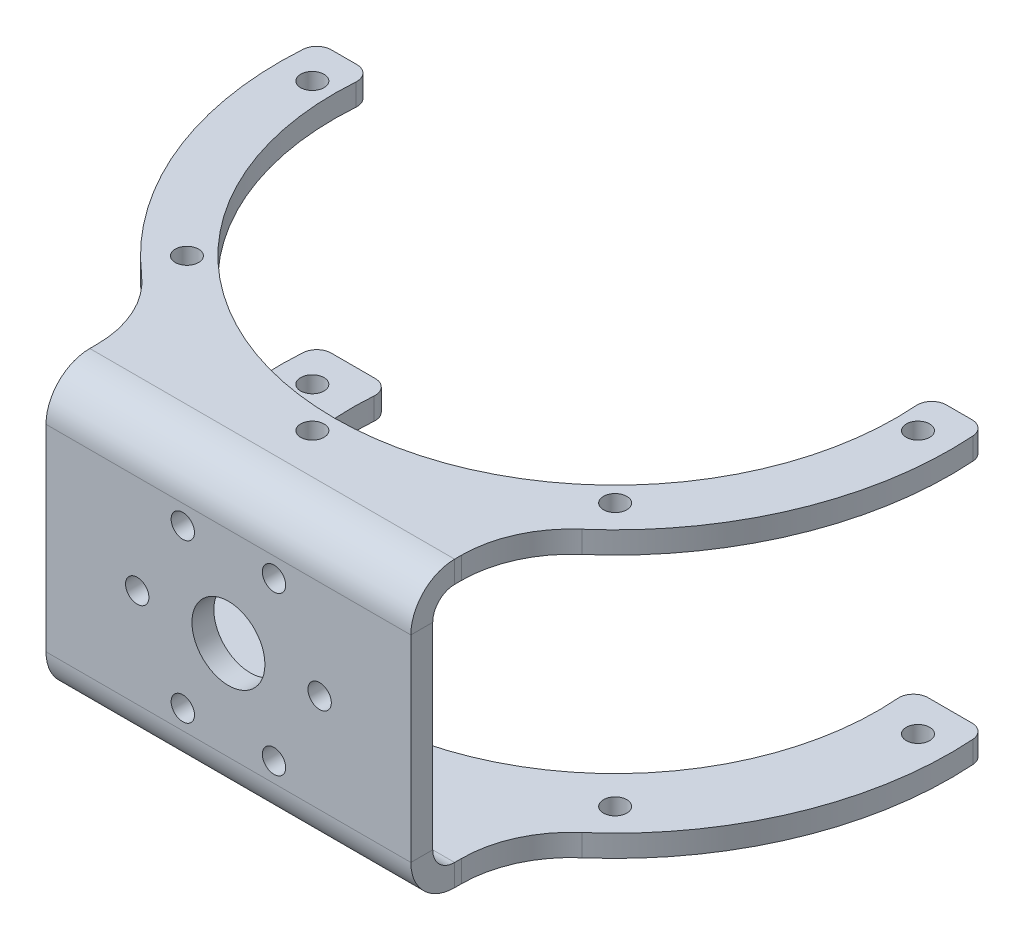
from build123d import *

# Parameters (mm, degrees)
SKETCH1_R                    = 1
BASE_FLANGE1_DEPTH           = 3
EDGE_FLANGE1_STRIP_W         = 18
EDGE_FLANGE1_STRIP_H         = 3
EDGE_FLANGE1_STRIP_CUT_DEPTH = 50
EDGE_FLANGE1_DEPTH           = 50
EDGE_FLANGE1_START           = 3
EDGE_FLANGE1_PROFILE_W       = 50
EDGE_FLANGE1_PROFILE_H       = 30
EDGE_FLANGE1_PROFILE_R       = 1
EDGE_FLANGE1_PROFILE_R_2     = 5
EDGE_FLANGE1_FLAT_DEPTH      = 3
EDGE_FLANGE2_STRIP_W         = 18
EDGE_FLANGE2_STRIP_H         = 3
EDGE_FLANGE2_STRIP_CUT_DEPTH = 50
EDGE_FLANGE2_DEPTH           = 50
EDGE_FLANGE2_START           = 3
EDGE_FLANGE2_PROFILE_R       = 1
EDGE_FLANGE2_FLAT_DEPTH      = 3
FILLET1_R                    = 15
FILLET2_R                    = 2
M3_CLEARANCE_HOLE1_D         = 3.2
M3_CLEARANCE_HOLE1_DEPTH     = 136
M3_CLEARANCE_HOLE1_TIP       = 0.96137699
M3_CLEARANCE_HOLE2_D         = 3.2
M3_CLEARANCE_HOLE2_DEPTH     = 136
M3_CLEARANCE_HOLE2_TIP       = 0.96137699


# Sheet-metal steps are written as plain solids
with BuildPart() as part:
    # Sketch1 → Base-Flange1 (new body)
    with BuildSketch(Plane(origin=(0, 0, 0), x_dir=(1, 0, 0), z_dir=(0, 1, 0))):
        with BuildLine():
            Line((-45.727453461, 5), (-35.65108694, 5))
            ThreePointArc((-35.65108694, 5), (0, -36), (35.65108694, 5))
            Line((35.65108694, 5), (45.727453461, 5))
            ThreePointArc((45.727453461, 5), (41.546682673, -19.745205972), (25, -38.613469153))
            Line((25, -38.613469153), (25, -50))
            Line((25, -50), (-25, -50))
            Line((-25, -50), (-25, -38.613469153))
            ThreePointArc((-25, -38.613469153), (-41.546682673, -19.745205972), (-45.727453461, 5))
        make_face()
        with Locations(Location((-41.5, 0, 0), (0, 0, 270))):
            Circle(SKETCH1_R, mode=Mode.SUBTRACT)
        with Locations(Location((41.5, 0, 0), (0, 0, 270))):
            Circle(SKETCH1_R, mode=Mode.SUBTRACT)
        with Locations(Location((-29.344931419, -29.344931419, 0), (0, 0, 270))):
            Circle(SKETCH1_R, mode=Mode.SUBTRACT)
        with Locations(Location((0, -41.5, 0), (0, 0, 270))):
            Circle(SKETCH1_R, mode=Mode.SUBTRACT)
        with Locations(Location((29.344931419, -29.344931419, 0), (0, 0, 270))):
            Circle(SKETCH1_R, mode=Mode.SUBTRACT)
    extrude(amount=-BASE_FLANGE1_DEPTH)

    # Edge-Flange1 strip (across the edge) → Edge-Flange1 strip cut (cut)
    with BuildSketch(Plane(origin=(-25, 0, 50), x_dir=(0, 0, -1), z_dir=(1, 0, 0))):
        with Locations((-6, -1.5)):
            Rectangle(EDGE_FLANGE1_STRIP_W, EDGE_FLANGE1_STRIP_H)
    extrude(amount=EDGE_FLANGE1_STRIP_CUT_DEPTH, mode=Mode.SUBTRACT)

    # Edge-Flange1 bend section (across the edge) → Edge-Flange1 (add)
    with BuildSketch(Plane(origin=(-25, 0, 50), x_dir=(0, 0, -1), z_dir=(1, 0, 0))):
        with BuildLine():
            Line((-3, 3), (0, 3))
            ThreePointArc((0, 3), (0.878679656, 0.878679656), (3, 0))
            Line((3, 0), (3, -3))
            ThreePointArc((3, -3), (-1.242640687, -1.242640687), (-3, 3))
        make_face()
    extrude(amount=EDGE_FLANGE1_DEPTH)

    # Edge-Flange1 profile (on flange) → Edge-Flange1 flat (add)
    with BuildSketch(Plane.XY.offset(50).offset(EDGE_FLANGE1_START)):
        with Locations((0, 18)):
            Rectangle(EDGE_FLANGE1_PROFILE_W, EDGE_FLANGE1_PROFILE_H)
        with Locations((-6.25, 5.674682453)):
            Circle(EDGE_FLANGE1_PROFILE_R, mode=Mode.SUBTRACT)
        with Locations((-12.5, 16.5)):
            Circle(EDGE_FLANGE1_PROFILE_R, mode=Mode.SUBTRACT)
        with Locations((6.25, 5.674682453)):
            Circle(EDGE_FLANGE1_PROFILE_R, mode=Mode.SUBTRACT)
        with Locations((0, 16.5)):
            Circle(EDGE_FLANGE1_PROFILE_R_2, mode=Mode.SUBTRACT)
        with Locations((-6.25, 27.325317547)):
            Circle(EDGE_FLANGE1_PROFILE_R, mode=Mode.SUBTRACT)
        with Locations((12.5, 16.5)):
            Circle(EDGE_FLANGE1_PROFILE_R, mode=Mode.SUBTRACT)
        with Locations((6.25, 27.325317547)):
            Circle(EDGE_FLANGE1_PROFILE_R, mode=Mode.SUBTRACT)
    extrude(amount=-EDGE_FLANGE1_FLAT_DEPTH)

    # Edge-Flange2 strip (across the edge) → Edge-Flange2 strip cut (cut)
    with BuildSketch(Plane(origin=(-25, 33, 50), x_dir=(0, -1, 0), z_dir=(1, 0, 0))):
        with Locations((-6, -1.5)):
            Rectangle(EDGE_FLANGE2_STRIP_W, EDGE_FLANGE2_STRIP_H)
    extrude(amount=EDGE_FLANGE2_STRIP_CUT_DEPTH, mode=Mode.SUBTRACT)

    # Edge-Flange2 bend section (across the edge) → Edge-Flange2 (add)
    with BuildSketch(Plane(origin=(-25, 33, 50), x_dir=(0, -1, 0), z_dir=(1, 0, 0))):
        with BuildLine():
            Line((-3, 3), (0, 3))
            ThreePointArc((0, 3), (0.878679656, 0.878679656), (3, 0))
            Line((3, 0), (3, -3))
            ThreePointArc((3, -3), (-1.242640687, -1.242640687), (-3, 3))
        make_face()
    extrude(amount=EDGE_FLANGE2_DEPTH)

    # Edge-Flange2 profile (on flange) → Edge-Flange2 flat (add)
    with BuildSketch(Plane(origin=(0, 33, 50), x_dir=(1, 0, 0), z_dir=(0, 1, 0)).offset(EDGE_FLANGE2_START)):
        with BuildLine():
            ThreePointArc((25, 11.386530847), (41.546682673, 30.254794028), (45.727453461, 55))
            Line((45.727453461, 55), (38.173943993, 55))
            ThreePointArc((38.173943993, 55), (0, 11.5), (-38.173943993, 55))
            Line((-38.173943993, 55), (-45.727453461, 55))
            ThreePointArc((-45.727453461, 55), (-41.546682673, 30.254794028), (-25, 11.386530847))
            Line((-25, 11.386530847), (-25, 3))
            Line((-25, 3), (25, 3))
            Line((25, 3), (25, 11.386530847))
        make_face()
        with Locations((29.35734241, 20.64265759)):
            Circle(EDGE_FLANGE2_PROFILE_R, mode=Mode.SUBTRACT)
        with Locations((0, 8.482448208)):
            Circle(EDGE_FLANGE2_PROFILE_R, mode=Mode.SUBTRACT)
        with Locations((-29.35734241, 20.64265759)):
            Circle(EDGE_FLANGE2_PROFILE_R, mode=Mode.SUBTRACT)
        with Locations((41.517551792, 50)):
            Circle(EDGE_FLANGE2_PROFILE_R, mode=Mode.SUBTRACT)
        with Locations((-41.517551792, 50)):
            Circle(EDGE_FLANGE2_PROFILE_R, mode=Mode.SUBTRACT)
    extrude(amount=-EDGE_FLANGE2_FLAT_DEPTH)

    # Fillet1
    fillet1_edges = [part.edges().sort_by_distance(p)[0] for p in [
        (-25, 34.5, 38.613469153),
        (25, 34.5, 38.613469153),
        (25, -1.5, 38.613469153),
        (-25, -1.5, 38.613469153),
    ]]
    fillet(fillet1_edges, radius=FILLET1_R)

    # Fillet2
    fillet2_edges = [part.edges().sort_by_distance(p)[0] for p in [
        (45.727453461, 34.5, -5),
        (38.173943993, 34.5, -5),
        (-38.173943993, 34.5, -5),
        (-45.727453461, 34.5, -5),
        (-45.727453461, -1.5, -5),
        (-35.65108694, -1.5, -5),
        (35.65108694, -1.5, -5),
        (45.727453461, -1.5, -5),
    ]]
    fillet(fillet2_edges, radius=FILLET2_R)

    # M3 Clearance Hole1
    with Locations(Plane(origin=(0, -3, 0), x_dir=(-1, 0, 0), z_dir=(0, -1, 0))):
        with Locations((41.5, 0), (29.344931419, -29.344931419), (0, -41.5), (-29.344931419, -29.344931419), (-41.5, 0)):
            Hole(M3_CLEARANCE_HOLE1_D / 2, depth=M3_CLEARANCE_HOLE1_DEPTH)
            with Locations((0, 0, -(M3_CLEARANCE_HOLE1_DEPTH + M3_CLEARANCE_HOLE1_TIP / 2))):  # 118° drill point
                Cone(0, M3_CLEARANCE_HOLE1_D / 2, M3_CLEARANCE_HOLE1_TIP, mode=Mode.SUBTRACT)

    # M3 Clearance Hole2
    with Locations(Plane(origin=(0, 0, 50), x_dir=(-1, 0, 0), z_dir=(0, 0, -1))):
        with Locations((6.25, 27.325317547), (12.5, 16.5), (6.25, 5.674682453), (-6.25, 5.674682453), (-12.5, 16.5), (-6.25, 27.325317547)):
            Hole(M3_CLEARANCE_HOLE2_D / 2, depth=M3_CLEARANCE_HOLE2_DEPTH)
            with Locations((0, 0, -(M3_CLEARANCE_HOLE2_DEPTH + M3_CLEARANCE_HOLE2_TIP / 2))):  # 118° drill point
                Cone(0, M3_CLEARANCE_HOLE2_D / 2, M3_CLEARANCE_HOLE2_TIP, mode=Mode.SUBTRACT)


solid = part.part
